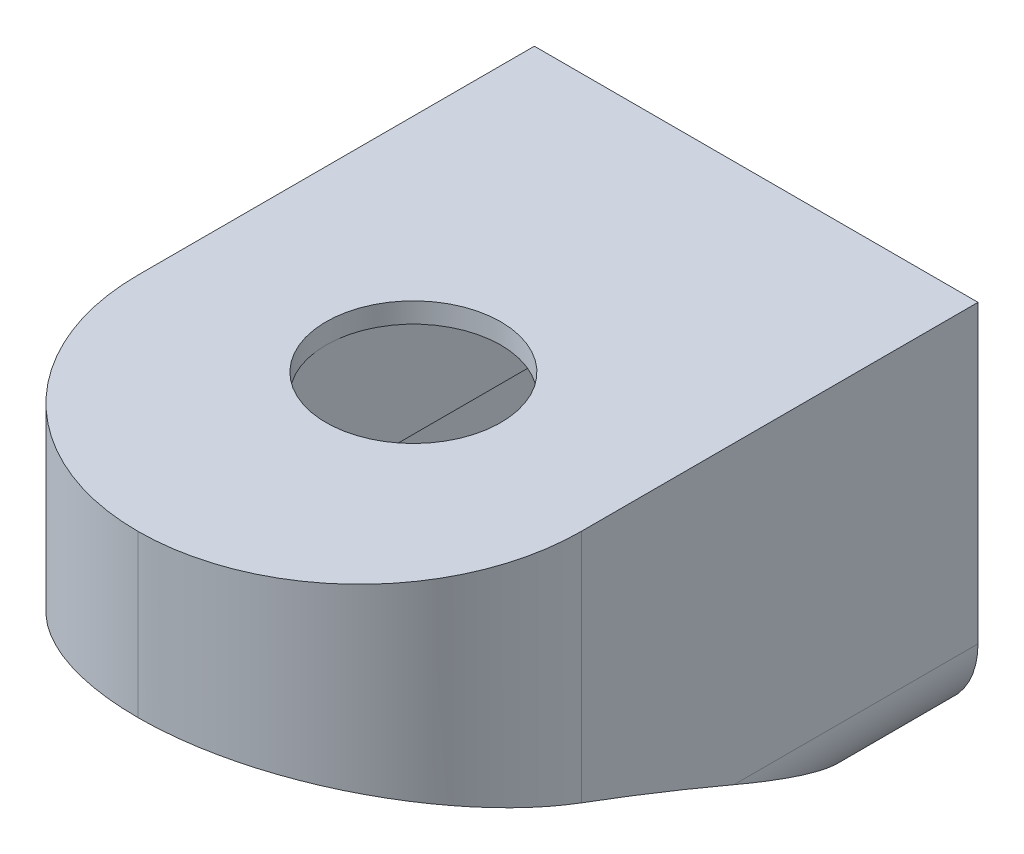
from build123d import *

# Parameters (mm, degrees)
SKETCH1_W           = 33
SKETCH1_H           = 28
BOSS_EXTRUDE1_DEPTH = 46
CUT_EXTRUDE1_DEPTH  = 59.318093247
CUT_EXTRUDE2_START  = -3
CUT_EXTRUDE2_DEPTH  = 27
FILLET2_R           = 12.5
FILLET3_R           = 16.5
FILLET4_R           = 6
SKETCH5_W           = 13
SKETCH5_H           = 23
CUT_EXTRUDE3_DEPTH  = 9
SKETCH6_R           = 6.5
CUT_EXTRUDE4_DEPTH  = 56.592265809
SKETCH7_R           = 1
CUT_EXTRUDE6_DEPTH  = 8
SKETCH8_R           = 1.3
SKETCH8_R_2         = 2.5
CUT_EXTRUDE7_DEPTH  = 2.5


with BuildPart() as part:
    # Sketch1 → Boss-Extrude1 (new body)
    with BuildSketch(Plane.XY):
        Rectangle(SKETCH1_W, SKETCH1_H)
    extrude(amount=BOSS_EXTRUDE1_DEPTH)

    # Sketch2 → Cut-Extrude1 (cut, through all)
    with BuildSketch(Plane(origin=(16.5, 0, 0), x_dir=(0, 0, -1), z_dir=(1, 0, 0))):
        with BuildLine():
            Line((-46, 2), (-46, -14))
            Line((-46, -14), (-5, -14))
            add(Edge.make_bspline(
                [(-5, -14), (-24.903930892, -4.26145895), (-46, 2)],
                knots=[0, 0, 0, 1, 1, 1], degree=2))
        make_face()
    extrude(amount=-CUT_EXTRUDE1_DEPTH, mode=Mode.SUBTRACT)

    # Sketch4 → Cut-Extrude2 (cut)
    with BuildSketch(Plane(origin=(16.5, 0, 0), x_dir=(0, 0, -1), z_dir=(1, 0, 0)).offset(CUT_EXTRUDE2_START)):
        with BuildLine():
            Line((-5, -14), (-2.5, -14))
            Line((-2.5, -14), (-2.5, 3.5))
            Line((-2.5, 3.5), (-40.5, 3.5))
            Line((-40.5, 3.5), (-40.5, 0.301980422))
            add(Edge.make_bspline(
                [(-5, -14), (-22.299705813, -5.535647097), (-40.5, 0.301980422)],
                knots=[0, 0, 0, 1, 1, 1], degree=2))
        make_face()
    extrude(amount=-CUT_EXTRUDE2_DEPTH, mode=Mode.SUBTRACT)

    # Fillet2
    fillet2_edges = [part.edges().sort_by_distance(p)[0] for p in [
        (-13.5, 1.900990211, 40.5),
        (13.5, 1.900990211, 40.5),
    ]]
    fillet(fillet2_edges, radius=FILLET2_R)

    # Fillet3
    fillet3_edges = [part.edges().sort_by_distance(p)[0] for p in [
        (-16.5, 8, 46),
        (16.5, 8, 46),
    ]]
    fillet(fillet3_edges, radius=FILLET3_R - 0.0001)  # a hair under: the kernel refuses the full size

    # Fillet4
    fillet4_edges = [part.edges().sort_by_distance(p)[0] for p in [
        (-16.5, -14, 2.5),
        (16.5, -14, 2.5),
    ]]
    fillet(fillet4_edges, radius=FILLET4_R)

    # Sketch5 → Cut-Extrude3 (cut)
    with BuildSketch(Plane.XZ.offset(-3.5)):
        with Locations((0, 20.5)):
            Rectangle(SKETCH5_W, SKETCH5_H)
    extrude(amount=-CUT_EXTRUDE3_DEPTH, mode=Mode.SUBTRACT)

    # Sketch6 → Cut-Extrude4 (cut, through all)
    with BuildSketch(Plane.XZ.offset(-12.5)):
        with Locations(Location((0, 25.5, 0), (0, 0, 270))):
            Circle(SKETCH6_R)
    extrude(amount=-CUT_EXTRUDE4_DEPTH, mode=Mode.SUBTRACT)

    # Sketch7 → Cut-Extrude6 (cut)
    with BuildSketch(Plane.XZ.offset(-3.5)):
        with Locations(Location((0, 34.052667497, 0), (0, 0, 270))):
            Circle(SKETCH7_R)
        with Locations(Location((0, 6.452667497, 0), (0, 0, 270))):
            Circle(SKETCH7_R)
    extrude(amount=-CUT_EXTRUDE6_DEPTH, mode=Mode.SUBTRACT)

    # Sketch8 → Cut-Extrude7 (cut)
    with BuildSketch(Plane(origin=(0, 0, 0), x_dir=(-1, 0, 0), z_dir=(0, 0, -1))):
        with Locations((-9.5, 0)):
            Circle(SKETCH8_R)
        with Locations((-5, 0)):
            Circle(SKETCH8_R_2)
        with Locations((-0.5, 0)):
            Circle(SKETCH8_R)
    extrude(amount=-CUT_EXTRUDE7_DEPTH, mode=Mode.SUBTRACT)


solid = part.part
